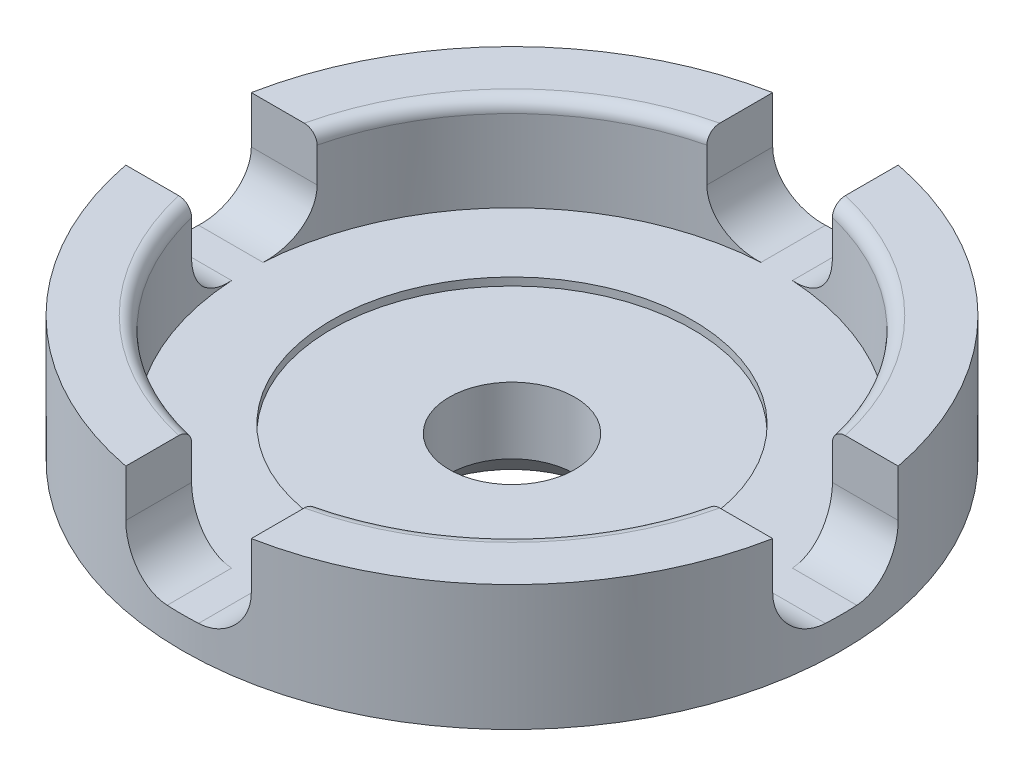
from build123d import *
from build123d.topology import SkipClean

# Parameters (mm, degrees)
SKETCH1_R      = 10.5
EXTRUDE1_DEPTH = 1
EXTRUDE6_DEPTH = 3
SKETCH9_R      = 5.75
EXTRUDE9_DEPTH = 0.25
SKETCH7_R      = 4.9
EXTRUDE7_DEPTH = 2.366666667
SKETCH8_R      = 2
EXTRUDE8_DEPTH = 17.156560415
FILLET2_R      = 0.4
CHAMFER2_SIZE  = 1
FILLET3_R      = 1.5


with BuildPart() as part:
    # Sketch1 → Extrude1 (new body)
    with BuildSketch(Plane(origin=(0, 0, 0), x_dir=(1, 0, 0), z_dir=(0, 1, 0))):
        with Locations(Location((0, 0, 0), (0, 0, 270))):
            Circle(SKETCH1_R)
    extrude(amount=EXTRUDE1_DEPTH)

    # Sketch6 → Extrude6 (add)
    with SkipClean():  # the faces are left unmerged after this step: merging them gives an invalid solid
        with BuildSketch(Plane(origin=(0, 1, 0), x_dir=(1, 0, 0), z_dir=(0, 1, 0))):
            with BuildLine():
                Line((-2, 10.307764064), (-2, 8.209902557))
                ThreePointArc((-2, 8.209902557), (-5.975052301, 5.975052301), (-8.209902557, 2))
                Line((-8.209902557, 2), (-10.307764064, 2))
                ThreePointArc((-10.307764064, 2), (-7.424621202, 7.424621202), (-2, 10.307764064))
            make_face()
            with BuildLine():
                Line((2, 10.307764064), (2, 8.209902557))
                ThreePointArc((2, 8.209902557), (5.975052301, 5.975052301), (8.209902557, 2))
                Line((8.209902557, 2), (10.307764064, 2))
                ThreePointArc((10.307764064, 2), (7.424621202, 7.424621202), (2, 10.307764064))
            make_face()
            with BuildLine():
                Line((10.307764064, -2), (8.209902557, -2))
                ThreePointArc((8.209902557, -2), (5.975052301, -5.975052301), (2, -8.209902557))
                Line((2, -8.209902557), (2, -10.307764064))
                ThreePointArc((2, -10.307764064), (7.424621202, -7.424621202), (10.307764064, -2))
            make_face()
            with BuildLine():
                Line((-2, -10.307764064), (-2, -8.209902557))
                ThreePointArc((-2, -8.209902557), (-5.975052301, -5.975052301), (-8.209902557, -2))
                Line((-8.209902557, -2), (-10.307764064, -2))
                ThreePointArc((-10.307764064, -2), (-7.424621202, -7.424621202), (-2, -10.307764064))
            make_face()
        extrude(amount=EXTRUDE6_DEPTH)

    # Sketch9 → Extrude9 (cut)
    with SkipClean():  # the faces are left unmerged after this step: merging them gives an invalid solid
        with BuildSketch(Plane(origin=(0, 1, 0), x_dir=(1, 0, 0), z_dir=(0, 1, 0))):
            with Locations(Location((0, 0, 0), (0, 0, 270))):
                Circle(SKETCH9_R)
        extrude(amount=-EXTRUDE9_DEPTH, mode=Mode.SUBTRACT)

    # Sketch7 → Extrude7 (add)
    with SkipClean():  # the faces are left unmerged after this step: merging them gives an invalid solid
        with BuildSketch(Plane.XZ):
            with Locations(Location((0, 0, 0), (0, 0, 270))):
                Circle(SKETCH7_R)
        extrude(amount=EXTRUDE7_DEPTH)

    # Sketch8 → Extrude8 (cut, through all)
    with SkipClean():  # the faces are left unmerged after this step: merging them gives an invalid solid
        with BuildSketch(Plane.XZ.offset(2.366666667)):
            with Locations(Location((0, 0, 0), (0, 0, 270))):
                Circle(SKETCH8_R)
        extrude(amount=-EXTRUDE8_DEPTH, mode=Mode.SUBTRACT)

    # Fillet2
    fillet2_edges = [part.edges().sort_by_distance(p)[0] for p in [
        (5.975052301, 4, -5.975052301),
        (5.975052301, 4, 5.975052301),
        (-5.975052301, 4, 5.975052301),
        (0, -2.366666667, 4.9),
        (-5.975052301, 4, -5.975052301),
    ]]
    fillet(fillet2_edges, radius=FILLET2_R)

    # Chamfer2
    chamfer2_edges = [part.edges().sort_by_distance(p)[0] for p in [
        (0, -2.366666667, 2),
    ]]
    chamfer(chamfer2_edges, length=CHAMFER2_SIZE)

    # Fillet3
    # the kernel refuses this fillet: 1.5 mm, written as the material it adds along each edge
    with BuildSketch(Plane(origin=(2, 1, -14.057764064), x_dir=(-1, 0, 0), z_dir=(0, 0, 1))) as fillet3_piece_1_section:
        with BuildLine():
            CenterArc((FILLET3_R, -FILLET3_R), FILLET3_R, 90, 90)
            Line((0, -FILLET3_R), (0, 0))
            Line((0, 0), (FILLET3_R, 0))
        make_face()
    fillet3_piece_1 = extrude(amount=9.597861507, mode=Mode.PRIVATE)
    fillet3_piece_1 = fillet3_piece_1 & Plane(origin=(0, 1.340711746, 0), x_dir=(0, 0, 1), z_dir=(0, -1, 0)) * Cylinder(10.5, 26, mode=Mode.PRIVATE)
    fillet3_piece_1 = fillet3_piece_1 - Plane(origin=(0, 1.340711746, 0), x_dir=(0.23668639053254556, 0, -0.9715861014530186), z_dir=(0, -1, 0)) * Cylinder(8.45, 26, mode=Mode.PRIVATE)
    with BuildSketch(Plane(origin=(4.459902557, 1, -2), x_dir=(0, 0, 1), z_dir=(1, 0, 0))) as fillet3_piece_2_section:
        with BuildLine():
            CenterArc((FILLET3_R, -FILLET3_R), FILLET3_R, 90, 90)
            Line((0, -FILLET3_R), (0, 0))
            Line((0, 0), (FILLET3_R, 0))
        make_face()
    fillet3_piece_2 = extrude(amount=9.597861507, mode=Mode.PRIVATE)
    fillet3_piece_2 = fillet3_piece_2 & Plane(origin=(0, 1.34071094, 0), x_dir=(0, 0, 1), z_dir=(0, -1, 0)) * Cylinder(10.5, 26, mode=Mode.PRIVATE)
    fillet3_piece_2 = fillet3_piece_2 - Plane(origin=(0, 1.34071094, 0), x_dir=(0.23668639053254556, 0, -0.9715861014530186), z_dir=(0, -1, 0)) * Cylinder(8.45, 26, mode=Mode.PRIVATE)
    with BuildSketch(Plane(origin=(14.057764064, 1, 2), x_dir=(0, 0, -1), z_dir=(-1, 0, 0))) as fillet3_piece_3_section:
        with BuildLine():
            CenterArc((FILLET3_R, -FILLET3_R), FILLET3_R, 90, 90)
            Line((0, -FILLET3_R), (0, 0))
            Line((0, 0), (FILLET3_R, 0))
        make_face()
    fillet3_piece_3 = extrude(amount=9.597861507, mode=Mode.PRIVATE)
    fillet3_piece_3 = fillet3_piece_3 & Plane(origin=(0, 1.340711718, 0), x_dir=(0, 0, 1), z_dir=(0, -1, 0)) * Cylinder(10.5, 26, mode=Mode.PRIVATE)
    fillet3_piece_3 = fillet3_piece_3 - Plane(origin=(0, 1.340711718, 0), x_dir=(0.9715861014530187, 0, 0.2366863905325454), z_dir=(0, -1, 0)) * Cylinder(8.45, 26, mode=Mode.PRIVATE)
    with BuildSketch(Plane(origin=(2, 1, 4.459902557), x_dir=(-1, 0, 0), z_dir=(0, 0, 1))) as fillet3_piece_4_section:
        with BuildLine():
            CenterArc((FILLET3_R, -FILLET3_R), FILLET3_R, 90, 90)
            Line((0, -FILLET3_R), (0, 0))
            Line((0, 0), (FILLET3_R, 0))
        make_face()
    fillet3_piece_4 = extrude(amount=9.597861507, mode=Mode.PRIVATE)
    fillet3_piece_4 = fillet3_piece_4 & Plane(origin=(0, 1.34071094, 0), x_dir=(0, 0, 1), z_dir=(0, -1, 0)) * Cylinder(10.5, 26, mode=Mode.PRIVATE)
    fillet3_piece_4 = fillet3_piece_4 - Plane(origin=(0, 1.34071094, 0), x_dir=(0.9715861014530187, 0, 0.2366863905325454), z_dir=(0, -1, 0)) * Cylinder(8.45, 26, mode=Mode.PRIVATE)
    with BuildSketch(Plane(origin=(-2, 1, 14.057764064), x_dir=(1, 0, 0), z_dir=(0, 0, -1))) as fillet3_piece_5_section:
        with BuildLine():
            CenterArc((FILLET3_R, -FILLET3_R), FILLET3_R, 90, 90)
            Line((0, -FILLET3_R), (0, 0))
            Line((0, 0), (FILLET3_R, 0))
        make_face()
    fillet3_piece_5 = extrude(amount=9.597861507, mode=Mode.PRIVATE)
    fillet3_piece_5 = fillet3_piece_5 & Plane(origin=(0, 1.340711184, 0), x_dir=(0, 0, 1), z_dir=(0, -1, 0)) * Cylinder(10.5, 26, mode=Mode.PRIVATE)
    fillet3_piece_5 = fillet3_piece_5 - Plane(origin=(0, 1.340711184, 0), x_dir=(-0.2366863905325458, 0, 0.9715861014530186), z_dir=(0, -1, 0)) * Cylinder(8.45, 26, mode=Mode.PRIVATE)
    with BuildSketch(Plane(origin=(-4.459902557, 1, 2), x_dir=(0, 0, -1), z_dir=(-1, 0, 0))) as fillet3_piece_6_section:
        with BuildLine():
            CenterArc((FILLET3_R, -FILLET3_R), FILLET3_R, 90, 90)
            Line((0, -FILLET3_R), (0, 0))
            Line((0, 0), (FILLET3_R, 0))
        make_face()
    fillet3_piece_6 = extrude(amount=9.597861507, mode=Mode.PRIVATE)
    fillet3_piece_6 = fillet3_piece_6 & Plane(origin=(0, 1.34071094, 0), x_dir=(0, 0, 1), z_dir=(0, -1, 0)) * Cylinder(10.5, 26, mode=Mode.PRIVATE)
    fillet3_piece_6 = fillet3_piece_6 - Plane(origin=(0, 1.34071094, 0), x_dir=(-0.2366863905325458, 0, 0.9715861014530186), z_dir=(0, -1, 0)) * Cylinder(8.45, 26, mode=Mode.PRIVATE)
    with BuildSketch(Plane(origin=(-4.459902557, 1, -2), x_dir=(0, 0, 1), z_dir=(-1, 0, 0))) as fillet3_piece_7_section:
        with BuildLine():
            CenterArc((FILLET3_R, FILLET3_R), FILLET3_R, 180, 90)
            Line((0, FILLET3_R), (0, 0))
            Line((0, 0), (FILLET3_R, 0))
        make_face()
    fillet3_piece_7 = extrude(amount=9.597861507, mode=Mode.PRIVATE)
    fillet3_piece_7 = fillet3_piece_7 & Plane(origin=(0, 1.340712249, 0), x_dir=(0, 0, 1), z_dir=(0, -1, 0)) * Cylinder(10.5, 26, mode=Mode.PRIVATE)
    fillet3_piece_7 = fillet3_piece_7 - Plane(origin=(0, 1.340712249, 0), x_dir=(-0.23668639053254495, 0, -0.9715861014530188), z_dir=(0, -1, 0)) * Cylinder(8.45, 26, mode=Mode.PRIVATE)
    with BuildSketch(Plane(origin=(-2, 1, -14.057764064), x_dir=(1, 0, 0), z_dir=(0, 0, 1))) as fillet3_piece_8_section:
        with BuildLine():
            CenterArc((FILLET3_R, FILLET3_R), FILLET3_R, 180, 90)
            Line((0, FILLET3_R), (0, 0))
            Line((0, 0), (FILLET3_R, 0))
        make_face()
    fillet3_piece_8 = extrude(amount=9.597861507, mode=Mode.PRIVATE)
    fillet3_piece_8 = fillet3_piece_8 & Plane(origin=(0, 1.340709875, 0), x_dir=(0, 0, 1), z_dir=(0, -1, 0)) * Cylinder(10.5, 26, mode=Mode.PRIVATE)
    fillet3_piece_8 = fillet3_piece_8 - Plane(origin=(0, 1.340709875, 0), x_dir=(-0.23668639053254495, 0, -0.9715861014530188), z_dir=(0, -1, 0)) * Cylinder(8.45, 26, mode=Mode.PRIVATE)
    add([fillet3_piece_1, fillet3_piece_2, fillet3_piece_3, fillet3_piece_4, fillet3_piece_5, fillet3_piece_6, fillet3_piece_7, fillet3_piece_8])


solid = part.part
